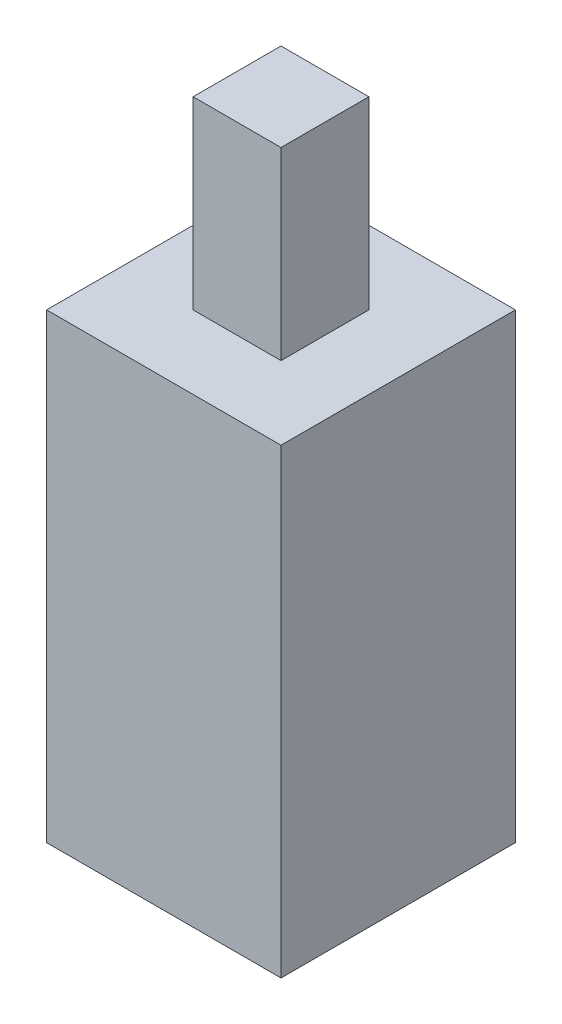
from build123d import *

# Parameters (mm, degrees)
SKETCH1_W           = 10.16
SKETCH1_H           = 10.16
BOSS_EXTRUDE1_DEPTH = 20
SKETCH2_W           = 3.81
SKETCH2_H           = 3.81
BOSS_EXTRUDE2_DEPTH = 8
SKETCH3_W           = 6
SKETCH3_H           = 6
CUT_EXTRUDE1_DEPTH  = 2


with BuildPart() as part:
    # Sketch1 → Boss-Extrude1 (new body)
    with BuildSketch(Plane(origin=(0, 0, 0), x_dir=(1, 0, 0), z_dir=(0, 1, 0))):
        with Locations((5.08, 5.08)):
            Rectangle(SKETCH1_W, SKETCH1_H)
    extrude(amount=BOSS_EXTRUDE1_DEPTH)

    # Sketch2 → Boss-Extrude2 (add)
    with BuildSketch(Plane(origin=(0, 20, 0), x_dir=(1, 0, 0), z_dir=(0, 1, 0))):
        with Locations((5.08, 5.08)):
            Rectangle(SKETCH2_W, SKETCH2_H)
    extrude(amount=BOSS_EXTRUDE2_DEPTH)

    # Sketch3 → Cut-Extrude1 (cut)
    with BuildSketch(Plane(origin=(0, 0, 0), x_dir=(-1, 0, 0), z_dir=(0, -1, 0))):
        with Locations((-5.08, 5.08)):
            Rectangle(SKETCH3_W, SKETCH3_H)
    extrude(amount=-CUT_EXTRUDE1_DEPTH, mode=Mode.SUBTRACT)


solid = part.part
